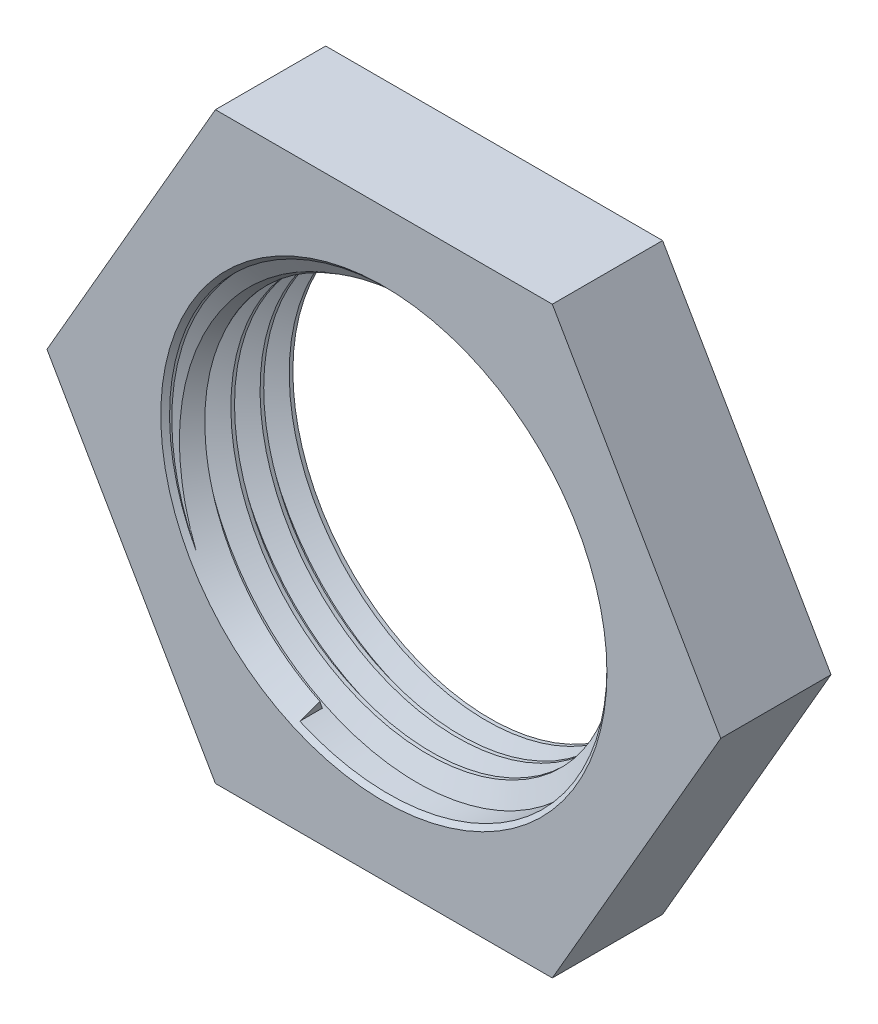
from build123d import *

# Parameters (mm, degrees)
SKETCH1_R               = 33.274
BOSS_EXTRUDE1_DEPTH     = 13.462
SKETCH2_R               = 11.8999
BOSS_EXTRUDE2_DEPTH     = 13.462
SKETCH5_R               = 3.302
CUT_EXTRUDE1_DEPTH      = 13.462
CIRPATTERN1_COUNT       = 4
CUT_SWEEP1_PITCH        = 1.5875
SKETCH6_R               = 12.137898
CUT_EXTRUDE2_DEPTH      = 2.54
CUT_EXTRUDE2_TAPER      = 45
SKETCH9_R               = 6.35
BOSS_EXTRUDE3_DEPTH     = 13.462
CUT_EXTRUDE3_DEPTH      = 49.944290767
CUT_EXTRUDE3_DEPTH_BACK = 49.944290767
SKETCH8_R               = 33.274
CUT_EXTRUDE4_DEPTH      = 40.055201703
CUT_EXTRUDE4_DEPTH_BACK = 40.055201703
SKETCH11_W              = 36.661742094
SKETCH11_H              = 7.462


with BuildPart() as part:
    # Sketch1 → Boss-Extrude1 (new body)
    with BuildSketch(Plane.XY):
        Circle(SKETCH1_R)
    extrude(amount=BOSS_EXTRUDE1_DEPTH)

    # Sketch5 → Cut-Extrude1 (cut)
    with BuildSketch(Plane.XY):
        with Locations((0, 26.543)):
            Circle(SKETCH5_R)
    cut_extrude1 = extrude(amount=CUT_EXTRUDE1_DEPTH, mode=Mode.SUBTRACT)

    # CirPattern1: Cut-Extrude1 ×4 about axis
    cirpattern1_axis = Axis((0, 0, 0), (0, 0, 1))
    for i in range(1, CIRPATTERN1_COUNT):
        add(cut_extrude1.rotate(cirpattern1_axis, i * 360 / CIRPATTERN1_COUNT), mode=Mode.SUBTRACT)


with BuildPart() as body_2:
    # Sketch2 → Boss-Extrude2 (new body)
    with BuildSketch(Plane.XY):
        with Locations(Location((0, 0, 0), (0, 0, 180))):
            Circle(SKETCH2_R)
    extrude(amount=BOSS_EXTRUDE2_DEPTH)

    # Cut-Sweep1: arcs per turn and ends read off the stored shape
    # Cut-Sweep1: the profile of Sketch3 profile screwed along a right-hand helix through 8.55874 turns, 8 arcs to a turn; built about Z, then put on its axis
    cut_sweep1_z = Axis((0, 0, 0), (0, 0, 1))
    cut_sweep1_corners = [(11.9002, 0, -0.198264295), (11.9002, 0, -1.587673205), (10.868788504, 0, -0.9921875), (10.868788504, 0, -0.79375)]
    with BuildLine(mode=Mode.PRIVATE) as cut_sweep1_profile:
        Line(cut_sweep1_corners[0], cut_sweep1_corners[1])
        Line(cut_sweep1_corners[1], cut_sweep1_corners[2])
        Line(cut_sweep1_corners[2], cut_sweep1_corners[3])
        Line(cut_sweep1_corners[3], cut_sweep1_corners[0])
    cut_sweep1_cap = Face(cut_sweep1_profile.wire())
    cut_sweep1_turn_angles = [0, 22.5, 45, 67.5, 90, 112.5, 135, 157.5, 180, 202.5, 225, 247.5, 270, 292.5, 315, 337.5, 360]
    cut_sweep1_turn_weights = [1, 0.9238795325112867, 1, 0.9238795325112867, 1, 0.9238795325112867, 1, 0.9238795325112867, 1, 0.9238795325112867, 1, 0.9238795325112867, 1, 0.9238795325112867, 1, 0.9238795325112867, 1]
    cut_sweep1_turn_rails = [Edge.make_bspline([Vector(p[0], p[1], 0).rotate(cut_sweep1_z, cut_sweep1_turn_angles[k]) / cut_sweep1_turn_weights[k] + Vector(0, 0, p[2] + CUT_SWEEP1_PITCH * cut_sweep1_turn_angles[k] / 360) for k in range(17)], [0, 0, 0, 1, 1, 2, 2, 3, 3, 4, 4, 5, 5, 6, 6, 7, 7, 8, 8, 8], 2, cut_sweep1_turn_weights) for p in cut_sweep1_corners]
    cut_sweep1_turn_sides = [Face.make_surface_from_curves(cut_sweep1_turn_rails[p[0]], cut_sweep1_turn_rails[p[1]]) for p in [(0, 1), (1, 2), (2, 3), (3, 0)]]
    cut_sweep1_last_angles = [2880, 2902.5, 2925, 2947.5, 2970, 2992.5, 3015, 3037.5, 3060, 3070.573228346, 3081.146456693]
    cut_sweep1_last_weights = [1, 0.9238795325112867, 1, 0.9238795325112867, 1, 0.9238795325112867, 1, 0.9238795325112867, 1, 0.9830211937588178, 1]
    cut_sweep1_last_rails = [Edge.make_bspline([Vector(p[0], p[1], 0).rotate(cut_sweep1_z, cut_sweep1_last_angles[k]) / cut_sweep1_last_weights[k] + Vector(0, 0, p[2] + CUT_SWEEP1_PITCH * cut_sweep1_last_angles[k] / 360) for k in range(11)], [0, 0, 0, 1, 1, 2, 2, 3, 3, 4, 4, 5, 5, 5], 2, cut_sweep1_last_weights) for p in cut_sweep1_corners]
    cut_sweep1_last_sides = [Face.make_surface_from_curves(cut_sweep1_last_rails[p[0]], cut_sweep1_last_rails[p[1]]) for p in [(0, 1), (1, 2), (2, 3), (3, 0)]]
    cut_sweep1 = Plane(origin=(0, 0, 0), x_dir=(0.7071067811865464, 0.7071067811865488, 0), z_dir=(0, 0, 1)) * Solid(Shell([*[p.moved(Location((0, 0, CUT_SWEEP1_PITCH * i))) for i in range(8) for p in cut_sweep1_turn_sides], *cut_sweep1_last_sides, cut_sweep1_cap, cut_sweep1_cap.rotate(cut_sweep1_z, 3081.146456693).moved(Location((0, 0, CUT_SWEEP1_PITCH * 3081.146456693 / 360)))]))
    add(cut_sweep1, mode=Mode.SUBTRACT)


with BuildPart() as part_1:
    add(part.part)

    # Combine1: cut body 2
    add(body_2.part, mode=Mode.SUBTRACT)

    # Sketch6 → Cut-Extrude2 (cut)
    with BuildSketch(Plane.XY):
        Circle(SKETCH6_R)
    cut_extrude2 = extrude(amount=CUT_EXTRUDE2_DEPTH, taper=CUT_EXTRUDE2_TAPER, mode=Mode.SUBTRACT)

    # Mirror1: Cut-Extrude2 across plane
    add(cut_extrude2.mirror(Plane(origin=(0, 0, 6.731), x_dir=(1, 0, 0), z_dir=(0, 0, -1))), mode=Mode.SUBTRACT)

    # Sketch9 → Boss-Extrude3 (add)
    with BuildSketch(Plane.XY.offset(13.462)):
        with Locations((-26.543, 0)):
            Circle(SKETCH9_R)
        with Locations((0, 26.543)):
            Circle(SKETCH9_R)
        with Locations((26.543, 0)):
            Circle(SKETCH9_R)
        with Locations((0, -26.543)):
            Circle(SKETCH9_R)
    extrude(amount=-BOSS_EXTRUDE3_DEPTH)

    # Sketch8 → Cut-Extrude3 (cut, two sides: drawn at the far end of the back side and taken through both)
    with BuildSketch(Plane.XY.offset(13.462).offset(-CUT_EXTRUDE3_DEPTH_BACK)):
        Circle(SKETCH8_R)
        Polygon((-9.165435523, 15.875), (9.165435523, 15.875), (18.330871047, 0), (9.165435523, -15.875), (-9.165435523, -15.875), (-18.330871047, 0), align=None, mode=Mode.SUBTRACT)
    extrude(amount=CUT_EXTRUDE3_DEPTH + CUT_EXTRUDE3_DEPTH_BACK, mode=Mode.SUBTRACT)

    # Sketch11 → Cut-Extrude4 (cut, two sides: drawn at the far end of the back side and taken through both)
    with BuildSketch(Plane.XZ.offset(15.875).offset(-CUT_EXTRUDE4_DEPTH_BACK)):
        with Locations((0, 3.731)):
            Rectangle(SKETCH11_W, SKETCH11_H)
    extrude(amount=CUT_EXTRUDE4_DEPTH + CUT_EXTRUDE4_DEPTH_BACK, mode=Mode.SUBTRACT)


solid = part_1.part
